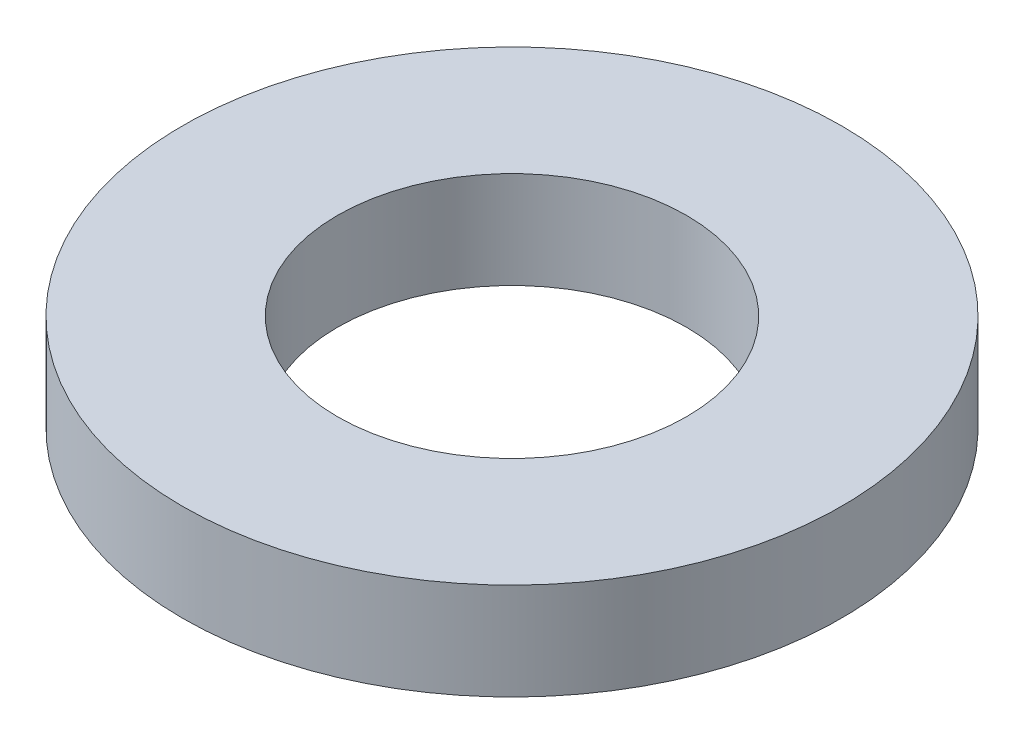
from build123d import *

# Parameters (mm, degrees)
SKETCH1_R           = 85
BOSS_EXTRUDE1_DEPTH = 25
SKETCH2_R           = 45
CUT_EXTRUDE1_DEPTH  = 123.780291578


with BuildPart() as part:
    # Sketch1 → Boss-Extrude1 (new body)
    with BuildSketch(Plane(origin=(0, 0, 0), x_dir=(1, 0, 0), z_dir=(0, 1, 0))):
        Circle(SKETCH1_R)
    extrude(amount=BOSS_EXTRUDE1_DEPTH)

    # Sketch2 → Cut-Extrude1 (cut, through all)
    with BuildSketch(Plane(origin=(0, 0, 0), x_dir=(1, 0, 0), z_dir=(0, 1, 0))):
        Circle(SKETCH2_R)
    extrude(amount=CUT_EXTRUDE1_DEPTH, mode=Mode.SUBTRACT)


solid = part.part
